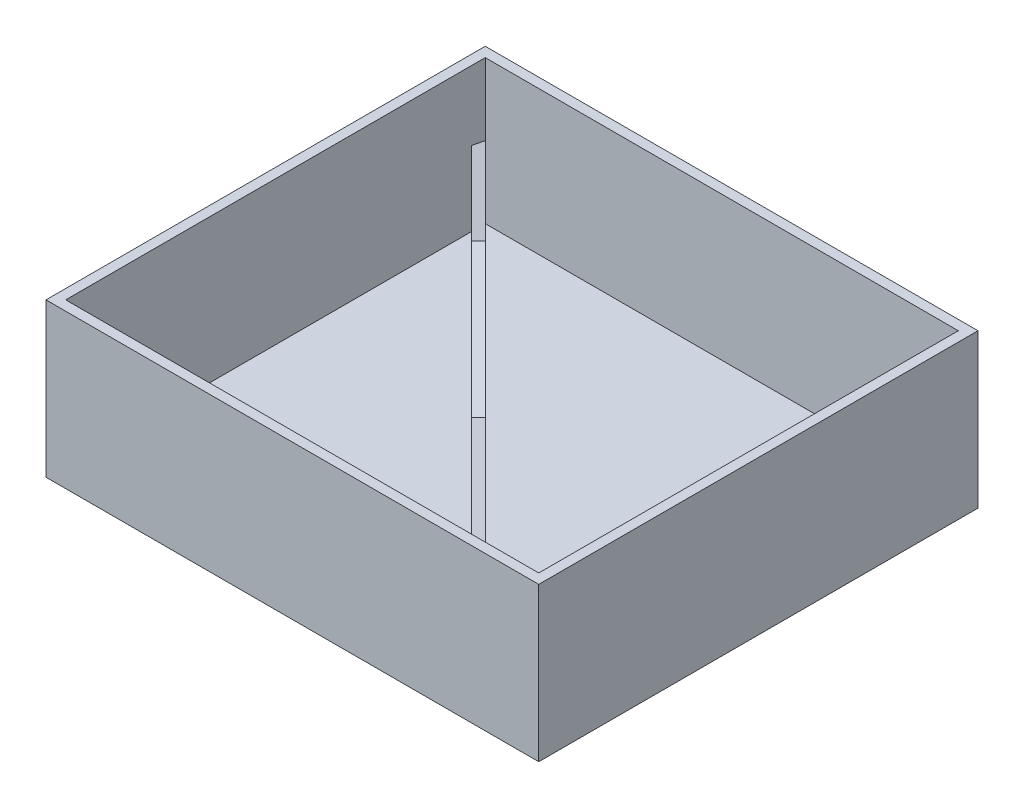
from build123d import *

# Parameters (mm, degrees)
SKETCH1_W                  = 127.078191072
SKETCH1_H                  = 113.282646321
BOSS_EXTRUDE1_DEPTH        = 39.624
SHELL_1_T                  = -2.54
OFFICIAL_RIB_BLOCK20_DEPTH = 2.54


# Read off the part's stored shape, not the designer's step: official_rib_block20
with BuildPart() as part:
    # Sketch1 → Boss-Extrude1 (new body)
    with BuildSketch(Plane(origin=(0, 0, 0), x_dir=(1, 0, 0), z_dir=(0, 1, 0))):
        with Locations((1.06119575, 7.295720781)):
            Rectangle(SKETCH1_W, SKETCH1_H)
    extrude(amount=BOSS_EXTRUDE1_DEPTH)

    # 抽壳1
    shell_1_openings = [part.faces().sort_by_distance(p)[0] for p in [
        (1.06119575, 39.624, -7.295720782),
    ]]
    offset(amount=SHELL_1_T, openings=shell_1_openings, kind=Kind.INTERSECTION)

    # official_rib_block20 outline → official_rib_block20 (add)
    with BuildSketch(Plane(origin=(0.729572078, 0, -0.729572078), x_dir=(0.7071067811865477, 0, 0.7071067811865475), z_dir=(-0.7071067811865475, 0, 0.7071067811865477))):
        Polygon((67.224888407, 33.535890054), (7.726, 25.357), (-34.23, 35.134), (-85.796761505, 21.08206499), (-86, 21.02668253), (-86, 2), (68, 2), (68, 33.642439145), align=None)
    extrude(amount=OFFICIAL_RIB_BLOCK20_DEPTH)


solid = part.part
